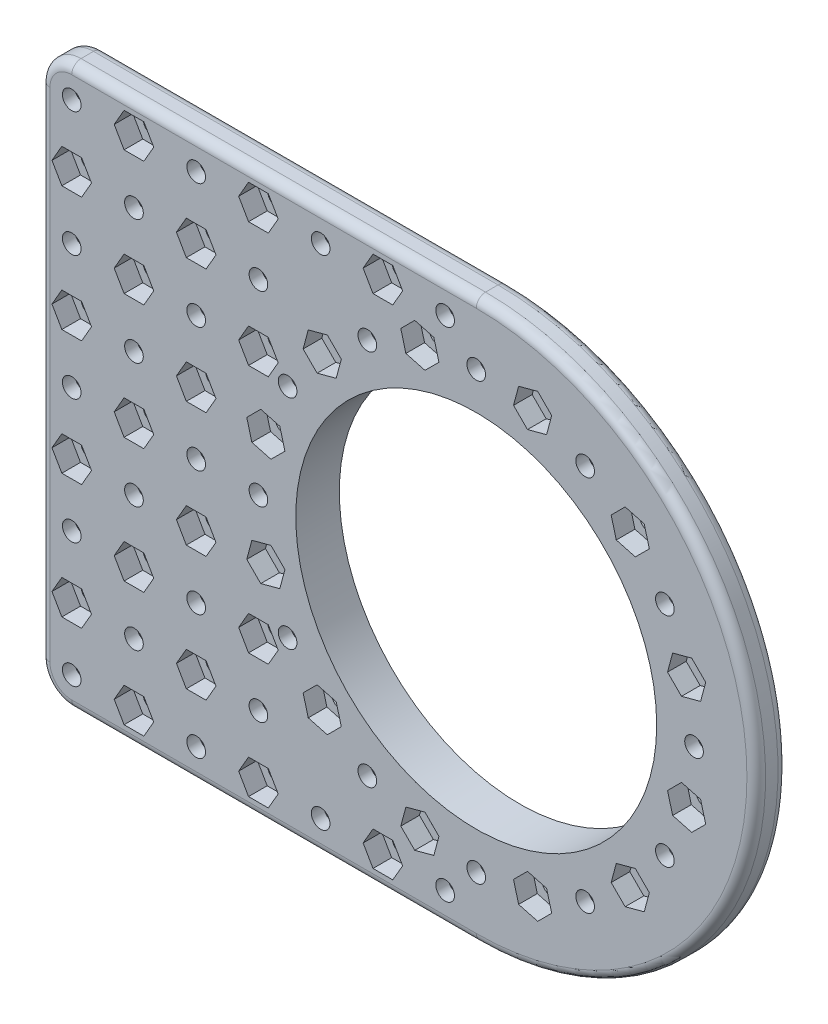
from build123d import *

# Parameters (mm, degrees)
EXTRUDE_1_DEPTH                   = 5
SKETCH_2_R                        = 29
CUT_EXTRUDE_1_DEPTH               = 92.923881554
SKETCH_3_R                        = 45
SKETCH_3_R_2                      = 29
EXTRUDE_2_DEPTH                   = 2
SKETCH_9_R                        = 45
SKETCH_9_R_2                      = 31
CUT_EXTRUDE_10_DEPTH              = 2
SKETCH_5_R                        = 1.5
CUT_EXTRUDE_2_DEPTH               = 92.923881554
CUT_EXTRUDE_3_DEPTH               = 3
SKETCH_10_R                       = 1.5
CUT_EXTRUDE_11_DEPTH              = 93.054331783
CUT_EXTRUDE_12_DEPTH              = 3
PATTERN_CIRCULAR_1_COUNT          = 12
SKETCH_12_R                       = 1.5
CUT_EXTRUDE_13_DEPTH              = 92.923881554
CUT_EXTRUDE_14_DEPTH              = 3
PATTERN_LINEAR_1_COUNT            = 5
PATTERN_LINEAR_1_PITCH            = 10
PATTERN_LINEAR_1_COL_COUNT        = 5
PATTERN_LINEAR_1_COL_PITCH        = 10
PATTERN_LINEAR_2_COUNT            = 3
PATTERN_LINEAR_2_PITCH            = 10
PATTERN_LINEAR_2_COPY_1_SKETCH_R  = 1.5
PATTERN_LINEAR_2_COPY_1_DEPTH     = 92.923881554
PATTERN_LINEAR_2_COPY_2_SKETCH_R  = 1.5
PATTERN_LINEAR_2_COPY_2_DEPTH     = 92.923881554
PATTERN_LINEAR_2_COPY_3_SKETCH_R  = 1.5
PATTERN_LINEAR_2_COPY_3_DEPTH     = 92.923881554
PATTERN_LINEAR_2_COPY_4_SKETCH_R  = 1.5
PATTERN_LINEAR_2_COPY_4_DEPTH     = 92.923881554
PATTERN_LINEAR_2_COPY_5_SKETCH_R  = 1.5
PATTERN_LINEAR_2_COPY_5_DEPTH     = 92.923881554
PATTERN_LINEAR_2_COPY_6_SKETCH_R  = 1.5
PATTERN_LINEAR_2_COPY_6_DEPTH     = 92.923881554
PATTERN_LINEAR_2_COPY_7_SKETCH_R  = 1.5
PATTERN_LINEAR_2_COPY_7_DEPTH     = 92.923881554
PATTERN_LINEAR_2_COPY_8_SKETCH_R  = 1.5
PATTERN_LINEAR_2_COPY_8_DEPTH     = 92.923881554
PATTERN_LINEAR_2_COPY_9_SKETCH_R  = 1.5
PATTERN_LINEAR_2_COPY_9_DEPTH     = 92.923881554
PATTERN_LINEAR_2_COPY_10_SKETCH_R = 1.5
PATTERN_LINEAR_2_COPY_10_DEPTH    = 92.923881554
PATTERN_LINEAR_2_COPY_11_SKETCH_R = 1.5
PATTERN_LINEAR_2_COPY_11_DEPTH    = 92.923881554
PATTERN_LINEAR_2_COPY_12_SKETCH_R = 1.5
PATTERN_LINEAR_2_COPY_12_DEPTH    = 92.923881554
PATTERN_LINEAR_2_COPY_13_SKETCH_R = 1.5
PATTERN_LINEAR_2_COPY_13_DEPTH    = 92.923881554
PATTERN_LINEAR_2_COPY_14_SKETCH_R = 1.5
PATTERN_LINEAR_2_COPY_14_DEPTH    = 92.923881554
PATTERN_LINEAR_2_COPY_15_SKETCH_R = 1.5
PATTERN_LINEAR_2_COPY_15_DEPTH    = 92.923881554
PATTERN_LINEAR_2_COPY_16_SKETCH_R = 1.5
PATTERN_LINEAR_2_COPY_16_DEPTH    = 92.923881554
PATTERN_LINEAR_3_COUNT            = 3
PATTERN_LINEAR_3_PITCH            = 20
PATTERN_LINEAR_3_COL_COUNT        = 3
PATTERN_LINEAR_3_COL_PITCH        = 20
CUT_EXTRUDE_16_DEPTH              = 3
PATTERN_LINEAR_5_COUNT            = 3
PATTERN_LINEAR_5_PITCH            = 20
PATTERN_LINEAR_5_COUNT_DIR2       = 3
PATTERN_LINEAR_5_PITCH_DIR2       = 20
PATTERN_LINEAR_4_COUNT            = 2
PATTERN_LINEAR_4_PITCH            = 20
PATTERN_LINEAR_4_COPY_1_DEPTH     = 3
PATTERN_LINEAR_4_COPY_2_DEPTH     = 3
PATTERN_LINEAR_4_COPY_3_DEPTH     = 3
PATTERN_LINEAR_4_COPY_4_DEPTH     = 3
PATTERN_LINEAR_4_COPY_5_DEPTH     = 3
PATTERN_LINEAR_4_COPY_6_DEPTH     = 3
PATTERN_LINEAR_4_COPY_7_DEPTH     = 3
PATTERN_LINEAR_4_COPY_8_DEPTH     = 3
PATTERN_LINEAR_4_COPY_9_DEPTH     = 3
PATTERN_LINEAR_4_COPY_10_DEPTH    = 3
PATTERN_LINEAR_4_COPY_11_DEPTH    = 3
PATTERN_LINEAR_4_COPY_12_DEPTH    = 3
SKETCH_14_R                       = 1.5
CUT_EXTRUDE_15_DEPTH              = 92.923881554
CUT_EXTRUDE_17_DEPTH              = 3
CUT_EXTRUDE_18_DEPTH              = 3
FILLET_4_R                        = 1.5
FILLET_5_R                        = 5


with BuildPart() as part:
    # 草图1 → 凸台-拉伸1 (new body)
    with BuildSketch(Plane.XY):
        with BuildLine():
            Line((-35, -45), (35, -45))
            ThreePointArc((35, -45), (80, 0), (35, 45))
            Line((35, 45), (-35, 45))
            Line((-35, 45), (-35, -45))
        make_face()
    extrude(amount=EXTRUDE_1_DEPTH)

    # 草图2 → 切除-拉伸1 (cut, through all)
    with BuildSketch(Plane.XY.offset(5)):
        with Locations((35, 0)):
            Circle(SKETCH_2_R)
    cut_extrude_1 = extrude(amount=-CUT_EXTRUDE_1_DEPTH, mode=Mode.SUBTRACT)

    # 草图3 → 凸台-拉伸2 (add)
    with BuildSketch(Plane.XY):
        with Locations(Location((35, 0, 0), (0, 0, 270))):
            Circle(SKETCH_3_R)
        with Locations((35, 0)):
            Circle(SKETCH_3_R_2, mode=Mode.SUBTRACT)
    extrude(amount=-EXTRUDE_2_DEPTH)

    # 草图9 → 切除-拉伸10 (cut)
    with BuildSketch(Plane(origin=(0, 0, -2), x_dir=(-1, 0, 0), z_dir=(0, 0, -1))):
        with Locations((-35, 0)):
            Circle(SKETCH_9_R)
        with Locations((-35, 0)):
            Circle(SKETCH_9_R_2, mode=Mode.SUBTRACT)
    extrude(amount=-CUT_EXTRUDE_10_DEPTH, mode=Mode.SUBTRACT)

    # 草图5 → 切除-拉伸2 (cut, through all)
    with BuildSketch(Plane(origin=(0, 0, 0), x_dir=(-1, 0, 0), z_dir=(0, 0, -1))):
        with Locations((-35, 35)):
            Circle(SKETCH_5_R)
    cut_extrude_2 = extrude(amount=-CUT_EXTRUDE_2_DEPTH, mode=Mode.SUBTRACT)

    # 草图6 → 切除-拉伸3 (cut)
    with BuildSketch(Plane(origin=(0, 0, 0), x_dir=(-1, 0, 0), z_dir=(0, 0, -1))):
        Polygon((-35, 31.824573519), (-32.25, 33.41228676), (-32.25, 36.58771324), (-35, 38.175426481), (-37.75, 36.58771324), (-37.75, 33.41228676), align=None)
    cut_extrude_3 = extrude(amount=-CUT_EXTRUDE_3_DEPTH, mode=Mode.SUBTRACT)

    # 草图10 → 切除-拉伸11 (cut, through all)
    with BuildSketch(Plane(origin=(0, 0, -2), x_dir=(-1, 0, 0), z_dir=(0, 0, -1))):
        with Locations((-25.941333421, 33.80740392)):
            Circle(SKETCH_10_R)
    cut_extrude_11 = extrude(amount=-CUT_EXTRUDE_11_DEPTH, mode=Mode.SUBTRACT)

    # 草图11 → 切除-拉伸12 (cut)
    with BuildSketch(Plane.XY.offset(5)):
        Polygon((26.763194271, 30.740177473), (29.008559868, 32.985543071), (28.186699019, 36.052769518), (25.119472572, 36.874630367), (22.874106974, 34.62926477), (23.695967824, 31.562038323), align=None)
    cut_extrude_12 = extrude(amount=-CUT_EXTRUDE_12_DEPTH, mode=Mode.SUBTRACT)

    # 阵列(圆周)1: 切除-拉伸1, 切除-拉伸2, 切除-拉伸3, 切除-拉伸11, 切除-拉伸12 ×12 about axis
    pattern_circular_1_axis = Axis((35, 0, 0), (0, 0, 1))
    add([cut_extrude_1.rotate(pattern_circular_1_axis, i * 360 / PATTERN_CIRCULAR_1_COUNT) for i in range(1, PATTERN_CIRCULAR_1_COUNT)], mode=Mode.SUBTRACT)
    add([cut_extrude_2.rotate(pattern_circular_1_axis, i * 360 / PATTERN_CIRCULAR_1_COUNT) for i in range(1, PATTERN_CIRCULAR_1_COUNT)], mode=Mode.SUBTRACT)
    add([cut_extrude_3.rotate(pattern_circular_1_axis, i * 360 / PATTERN_CIRCULAR_1_COUNT) for i in range(1, PATTERN_CIRCULAR_1_COUNT)], mode=Mode.SUBTRACT)
    add([cut_extrude_11.rotate(pattern_circular_1_axis, i * 360 / PATTERN_CIRCULAR_1_COUNT) for i in range(1, PATTERN_CIRCULAR_1_COUNT)], mode=Mode.SUBTRACT)
    add([cut_extrude_12.rotate(pattern_circular_1_axis, i * 360 / PATTERN_CIRCULAR_1_COUNT) for i in range(1, PATTERN_CIRCULAR_1_COUNT)], mode=Mode.SUBTRACT)

    # 草图12 → 切除-拉伸13 (cut, through all)
    with BuildSketch(Plane(origin=(0, 0, 0), x_dir=(-1, 0, 0), z_dir=(0, 0, -1))):
        with Locations((30, 0)):
            Circle(SKETCH_12_R)
    cut_extrude_13 = extrude(amount=-CUT_EXTRUDE_13_DEPTH, mode=Mode.SUBTRACT)

    # 草图13 → 切除-拉伸14 (cut)
    with BuildSketch(Plane(origin=(0, 0, 0), x_dir=(-1, 0, 0), z_dir=(0, 0, -1))):
        Polygon((26.824573519, 0), (28.41228676, -2.75), (31.58771324, -2.75), (33.175426481, 0), (31.58771324, 2.75), (28.41228676, 2.75), align=None)
    cut_extrude_14 = extrude(amount=-CUT_EXTRUDE_14_DEPTH, mode=Mode.SUBTRACT)

    # 阵列(线性)1: 切除-拉伸13 ×5
    with Locations(*[(0, -i * PATTERN_LINEAR_1_PITCH, 0) for i in range(1, PATTERN_LINEAR_1_COUNT)]):
        add(cut_extrude_13, mode=Mode.SUBTRACT)

    # 阵列(线性)1 col: 切除-拉伸13 ×5
    with Locations(*[(0, i * PATTERN_LINEAR_1_COL_PITCH, 0) for i in range(1, PATTERN_LINEAR_1_COL_COUNT)]):
        add(cut_extrude_13, mode=Mode.SUBTRACT)

    # 阵列(线性)2: 切除-拉伸13 ×3
    with Locations(*[(i * PATTERN_LINEAR_2_PITCH, 0, 0) for i in range(1, PATTERN_LINEAR_2_COUNT)]):
        add(cut_extrude_13, mode=Mode.SUBTRACT)

    # 阵列(线性)2 copy 1 sketch → 阵列(线性)2 copy 1 (cut, through all)
    with BuildSketch(Plane(origin=(10, -10, 0), x_dir=(-1, 0, 0), z_dir=(0, 0, -1))):
        with Locations((30, 0)):
            Circle(PATTERN_LINEAR_2_COPY_1_SKETCH_R)
    extrude(amount=-PATTERN_LINEAR_2_COPY_1_DEPTH, mode=Mode.SUBTRACT)

    # 阵列(线性)2 copy 2 sketch → 阵列(线性)2 copy 2 (cut, through all)
    with BuildSketch(Plane(origin=(20, -10, 0), x_dir=(-1, 0, 0), z_dir=(0, 0, -1))):
        with Locations((30, 0)):
            Circle(PATTERN_LINEAR_2_COPY_2_SKETCH_R)
    extrude(amount=-PATTERN_LINEAR_2_COPY_2_DEPTH, mode=Mode.SUBTRACT)

    # 阵列(线性)2 copy 3 sketch → 阵列(线性)2 copy 3 (cut, through all)
    with BuildSketch(Plane(origin=(10, -20, 0), x_dir=(-1, 0, 0), z_dir=(0, 0, -1))):
        with Locations((30, 0)):
            Circle(PATTERN_LINEAR_2_COPY_3_SKETCH_R)
    extrude(amount=-PATTERN_LINEAR_2_COPY_3_DEPTH, mode=Mode.SUBTRACT)

    # 阵列(线性)2 copy 4 sketch → 阵列(线性)2 copy 4 (cut, through all)
    with BuildSketch(Plane(origin=(20, -20, 0), x_dir=(-1, 0, 0), z_dir=(0, 0, -1))):
        with Locations((30, 0)):
            Circle(PATTERN_LINEAR_2_COPY_4_SKETCH_R)
    extrude(amount=-PATTERN_LINEAR_2_COPY_4_DEPTH, mode=Mode.SUBTRACT)

    # 阵列(线性)2 copy 5 sketch → 阵列(线性)2 copy 5 (cut, through all)
    with BuildSketch(Plane(origin=(10, -30, 0), x_dir=(-1, 0, 0), z_dir=(0, 0, -1))):
        with Locations((30, 0)):
            Circle(PATTERN_LINEAR_2_COPY_5_SKETCH_R)
    extrude(amount=-PATTERN_LINEAR_2_COPY_5_DEPTH, mode=Mode.SUBTRACT)

    # 阵列(线性)2 copy 6 sketch → 阵列(线性)2 copy 6 (cut, through all)
    with BuildSketch(Plane(origin=(20, -30, 0), x_dir=(-1, 0, 0), z_dir=(0, 0, -1))):
        with Locations((30, 0)):
            Circle(PATTERN_LINEAR_2_COPY_6_SKETCH_R)
    extrude(amount=-PATTERN_LINEAR_2_COPY_6_DEPTH, mode=Mode.SUBTRACT)

    # 阵列(线性)2 copy 7 sketch → 阵列(线性)2 copy 7 (cut, through all)
    with BuildSketch(Plane(origin=(10, -40, 0), x_dir=(-1, 0, 0), z_dir=(0, 0, -1))):
        with Locations((30, 0)):
            Circle(PATTERN_LINEAR_2_COPY_7_SKETCH_R)
    extrude(amount=-PATTERN_LINEAR_2_COPY_7_DEPTH, mode=Mode.SUBTRACT)

    # 阵列(线性)2 copy 8 sketch → 阵列(线性)2 copy 8 (cut, through all)
    with BuildSketch(Plane(origin=(20, -40, 0), x_dir=(-1, 0, 0), z_dir=(0, 0, -1))):
        with Locations((30, 0)):
            Circle(PATTERN_LINEAR_2_COPY_8_SKETCH_R)
    extrude(amount=-PATTERN_LINEAR_2_COPY_8_DEPTH, mode=Mode.SUBTRACT)

    # 阵列(线性)2 copy 9 sketch → 阵列(线性)2 copy 9 (cut, through all)
    with BuildSketch(Plane(origin=(10, 10, 0), x_dir=(-1, 0, 0), z_dir=(0, 0, -1))):
        with Locations((30, 0)):
            Circle(PATTERN_LINEAR_2_COPY_9_SKETCH_R)
    extrude(amount=-PATTERN_LINEAR_2_COPY_9_DEPTH, mode=Mode.SUBTRACT)

    # 阵列(线性)2 copy 10 sketch → 阵列(线性)2 copy 10 (cut, through all)
    with BuildSketch(Plane(origin=(20, 10, 0), x_dir=(-1, 0, 0), z_dir=(0, 0, -1))):
        with Locations((30, 0)):
            Circle(PATTERN_LINEAR_2_COPY_10_SKETCH_R)
    extrude(amount=-PATTERN_LINEAR_2_COPY_10_DEPTH, mode=Mode.SUBTRACT)

    # 阵列(线性)2 copy 11 sketch → 阵列(线性)2 copy 11 (cut, through all)
    with BuildSketch(Plane(origin=(10, 20, 0), x_dir=(-1, 0, 0), z_dir=(0, 0, -1))):
        with Locations((30, 0)):
            Circle(PATTERN_LINEAR_2_COPY_11_SKETCH_R)
    extrude(amount=-PATTERN_LINEAR_2_COPY_11_DEPTH, mode=Mode.SUBTRACT)

    # 阵列(线性)2 copy 12 sketch → 阵列(线性)2 copy 12 (cut, through all)
    with BuildSketch(Plane(origin=(20, 20, 0), x_dir=(-1, 0, 0), z_dir=(0, 0, -1))):
        with Locations((30, 0)):
            Circle(PATTERN_LINEAR_2_COPY_12_SKETCH_R)
    extrude(amount=-PATTERN_LINEAR_2_COPY_12_DEPTH, mode=Mode.SUBTRACT)

    # 阵列(线性)2 copy 13 sketch → 阵列(线性)2 copy 13 (cut, through all)
    with BuildSketch(Plane(origin=(10, 30, 0), x_dir=(-1, 0, 0), z_dir=(0, 0, -1))):
        with Locations((30, 0)):
            Circle(PATTERN_LINEAR_2_COPY_13_SKETCH_R)
    extrude(amount=-PATTERN_LINEAR_2_COPY_13_DEPTH, mode=Mode.SUBTRACT)

    # 阵列(线性)2 copy 14 sketch → 阵列(线性)2 copy 14 (cut, through all)
    with BuildSketch(Plane(origin=(20, 30, 0), x_dir=(-1, 0, 0), z_dir=(0, 0, -1))):
        with Locations((30, 0)):
            Circle(PATTERN_LINEAR_2_COPY_14_SKETCH_R)
    extrude(amount=-PATTERN_LINEAR_2_COPY_14_DEPTH, mode=Mode.SUBTRACT)

    # 阵列(线性)2 copy 15 sketch → 阵列(线性)2 copy 15 (cut, through all)
    with BuildSketch(Plane(origin=(10, 40, 0), x_dir=(-1, 0, 0), z_dir=(0, 0, -1))):
        with Locations((30, 0)):
            Circle(PATTERN_LINEAR_2_COPY_15_SKETCH_R)
    extrude(amount=-PATTERN_LINEAR_2_COPY_15_DEPTH, mode=Mode.SUBTRACT)

    # 阵列(线性)2 copy 16 sketch → 阵列(线性)2 copy 16 (cut, through all)
    with BuildSketch(Plane(origin=(20, 40, 0), x_dir=(-1, 0, 0), z_dir=(0, 0, -1))):
        with Locations((30, 0)):
            Circle(PATTERN_LINEAR_2_COPY_16_SKETCH_R)
    extrude(amount=-PATTERN_LINEAR_2_COPY_16_DEPTH, mode=Mode.SUBTRACT)

    # 阵列(线性)3: 切除-拉伸14 ×3
    with Locations(*[(0, -i * PATTERN_LINEAR_3_PITCH, 0) for i in range(1, PATTERN_LINEAR_3_COUNT)]):
        add(cut_extrude_14, mode=Mode.SUBTRACT)

    # 阵列(线性)3 col: 切除-拉伸14 ×3
    with Locations(*[(0, i * PATTERN_LINEAR_3_COL_PITCH, 0) for i in range(1, PATTERN_LINEAR_3_COL_COUNT)]):
        add(cut_extrude_14, mode=Mode.SUBTRACT)

    # 草图15 → 切除-拉伸16 (cut)
    with BuildSketch(Plane.XY.offset(5)):
        Polygon((-28.41228676, 7.25), (-26.824573519, 10), (-28.41228676, 12.75), (-31.58771324, 12.75), (-33.175426481, 10), (-31.58771324, 7.25), align=None)
    cut_extrude_16 = extrude(amount=-CUT_EXTRUDE_16_DEPTH, mode=Mode.SUBTRACT)

    # 阵列(线性)5: Cut-Extrude 16 3 × 3
    with Locations(*[Vector(0, -1, 0) * (i * PATTERN_LINEAR_5_PITCH) + Vector(0, 1, 0) * (j * PATTERN_LINEAR_5_PITCH_DIR2) for i in range(PATTERN_LINEAR_5_COUNT) for j in range(PATTERN_LINEAR_5_COUNT_DIR2) if (i, j) != (0, 0)]):
        add(cut_extrude_16, mode=Mode.SUBTRACT)

    # 阵列(线性)4: 切除-拉伸14, 切除-拉伸16 ×2
    with Locations(*[(i * PATTERN_LINEAR_4_PITCH, 0, 0) for i in range(1, PATTERN_LINEAR_4_COUNT)]):
        add(cut_extrude_14, mode=Mode.SUBTRACT)
        add(cut_extrude_16, mode=Mode.SUBTRACT)

    # 阵列(线性)4 copy 1 sketch → 阵列(线性)4 copy 1 (cut)
    with BuildSketch(Plane(origin=(20, -20, 0), x_dir=(-1, 0, 0), z_dir=(0, 0, -1))):
        Polygon((26.824573519, 0), (28.41228676, -2.75), (31.58771324, -2.75), (33.175426481, 0), (31.58771324, 2.75), (28.41228676, 2.75), align=None)
    extrude(amount=-PATTERN_LINEAR_4_COPY_1_DEPTH, mode=Mode.SUBTRACT)

    # 阵列(线性)4 copy 2 sketch → 阵列(线性)4 copy 2 (cut)
    with BuildSketch(Plane(origin=(20, -40, 0), x_dir=(-1, 0, 0), z_dir=(0, 0, -1))):
        Polygon((26.824573519, 0), (28.41228676, -2.75), (31.58771324, -2.75), (33.175426481, 0), (31.58771324, 2.75), (28.41228676, 2.75), align=None)
    extrude(amount=-PATTERN_LINEAR_4_COPY_2_DEPTH, mode=Mode.SUBTRACT)

    # 阵列(线性)4 copy 3 sketch → 阵列(线性)4 copy 3 (cut)
    with BuildSketch(Plane(origin=(20, 20, 0), x_dir=(-1, 0, 0), z_dir=(0, 0, -1))):
        Polygon((26.824573519, 0), (28.41228676, -2.75), (31.58771324, -2.75), (33.175426481, 0), (31.58771324, 2.75), (28.41228676, 2.75), align=None)
    extrude(amount=-PATTERN_LINEAR_4_COPY_3_DEPTH, mode=Mode.SUBTRACT)

    # 阵列(线性)4 copy 4 sketch → 阵列(线性)4 copy 4 (cut)
    with BuildSketch(Plane(origin=(20, 40, 0), x_dir=(-1, 0, 0), z_dir=(0, 0, -1))):
        Polygon((26.824573519, 0), (28.41228676, -2.75), (31.58771324, -2.75), (33.175426481, 0), (31.58771324, 2.75), (28.41228676, 2.75), align=None)
    extrude(amount=-PATTERN_LINEAR_4_COPY_4_DEPTH, mode=Mode.SUBTRACT)

    # 阵列(线性)4 copy 5 sketch → 阵列(线性)4 copy 5 (cut)
    with BuildSketch(Plane(origin=(20, 20, 5), x_dir=(1, 0, 0), z_dir=(0, 0, 1))):
        Polygon((-28.41228676, 7.25), (-26.824573519, 10), (-28.41228676, 12.75), (-31.58771324, 12.75), (-33.175426481, 10), (-31.58771324, 7.25), align=None)
    extrude(amount=-PATTERN_LINEAR_4_COPY_5_DEPTH, mode=Mode.SUBTRACT)

    # 阵列(线性)4 copy 6 sketch → 阵列(线性)4 copy 6 (cut)
    with BuildSketch(Plane(origin=(20, 40, 5), x_dir=(1, 0, 0), z_dir=(0, 0, 1))):
        Polygon((-28.41228676, 7.25), (-26.824573519, 10), (-28.41228676, 12.75), (-31.58771324, 12.75), (-33.175426481, 10), (-31.58771324, 7.25), align=None)
    extrude(amount=-PATTERN_LINEAR_4_COPY_6_DEPTH, mode=Mode.SUBTRACT)

    # 阵列(线性)4 copy 7 sketch → 阵列(线性)4 copy 7 (cut)
    with BuildSketch(Plane(origin=(20, -20, 5), x_dir=(1, 0, 0), z_dir=(0, 0, 1))):
        Polygon((-28.41228676, 7.25), (-26.824573519, 10), (-28.41228676, 12.75), (-31.58771324, 12.75), (-33.175426481, 10), (-31.58771324, 7.25), align=None)
    extrude(amount=-PATTERN_LINEAR_4_COPY_7_DEPTH, mode=Mode.SUBTRACT)

    # 阵列(线性)4 copy 8 sketch → 阵列(线性)4 copy 8 (cut)
    with BuildSketch(Plane(origin=(20, 0, 5), x_dir=(1, 0, 0), z_dir=(0, 0, 1))):
        Polygon((-28.41228676, 7.25), (-26.824573519, 10), (-28.41228676, 12.75), (-31.58771324, 12.75), (-33.175426481, 10), (-31.58771324, 7.25), align=None)
    extrude(amount=-PATTERN_LINEAR_4_COPY_8_DEPTH, mode=Mode.SUBTRACT)

    # 阵列(线性)4 copy 9 sketch → 阵列(线性)4 copy 9 (cut)
    with BuildSketch(Plane(origin=(20, 20, 5), x_dir=(1, 0, 0), z_dir=(0, 0, 1))):
        Polygon((-28.41228676, 7.25), (-26.824573519, 10), (-28.41228676, 12.75), (-31.58771324, 12.75), (-33.175426481, 10), (-31.58771324, 7.25), align=None)
    extrude(amount=-PATTERN_LINEAR_4_COPY_9_DEPTH, mode=Mode.SUBTRACT)

    # 阵列(线性)4 copy 10 sketch → 阵列(线性)4 copy 10 (cut)
    with BuildSketch(Plane(origin=(20, -40, 5), x_dir=(1, 0, 0), z_dir=(0, 0, 1))):
        Polygon((-28.41228676, 7.25), (-26.824573519, 10), (-28.41228676, 12.75), (-31.58771324, 12.75), (-33.175426481, 10), (-31.58771324, 7.25), align=None)
    extrude(amount=-PATTERN_LINEAR_4_COPY_10_DEPTH, mode=Mode.SUBTRACT)

    # 阵列(线性)4 copy 11 sketch → 阵列(线性)4 copy 11 (cut)
    with BuildSketch(Plane(origin=(20, -20, 5), x_dir=(1, 0, 0), z_dir=(0, 0, 1))):
        Polygon((-28.41228676, 7.25), (-26.824573519, 10), (-28.41228676, 12.75), (-31.58771324, 12.75), (-33.175426481, 10), (-31.58771324, 7.25), align=None)
    extrude(amount=-PATTERN_LINEAR_4_COPY_11_DEPTH, mode=Mode.SUBTRACT)

    # 阵列(线性)4 copy 12 sketch → 阵列(线性)4 copy 12 (cut)
    with BuildSketch(Plane(origin=(20, 0, 5), x_dir=(1, 0, 0), z_dir=(0, 0, 1))):
        Polygon((-28.41228676, 7.25), (-26.824573519, 10), (-28.41228676, 12.75), (-31.58771324, 12.75), (-33.175426481, 10), (-31.58771324, 7.25), align=None)
    extrude(amount=-PATTERN_LINEAR_4_COPY_12_DEPTH, mode=Mode.SUBTRACT)

    # 草图14 → 切除-拉伸15 (cut, through all)
    with BuildSketch(Plane(origin=(0, 0, 0), x_dir=(-1, 0, 0), z_dir=(0, 0, -1))):
        with Locations((0, 40)):
            Circle(SKETCH_14_R)
        with Locations((0, 30)):
            Circle(SKETCH_14_R)
        with Locations((-10, 40)):
            Circle(SKETCH_14_R)
        with Locations((-20, 40)):
            Circle(SKETCH_14_R)
        with Locations((0, 20)):
            Circle(SKETCH_14_R)
        with Locations((-30, 40)):
            Circle(SKETCH_14_R)
    cut_extrude_15 = extrude(amount=-CUT_EXTRUDE_15_DEPTH, mode=Mode.SUBTRACT)

    # 草图16 → 切除-拉伸17 (cut)
    with BuildSketch(Plane(origin=(0, 0, 0), x_dir=(-1, 0, 0), z_dir=(0, 0, -1))):
        Polygon((23.175426481, 30), (21.58771324, 32.75), (18.41228676, 32.75), (16.824573519, 30), (18.41228676, 27.25), (21.58771324, 27.25), align=None)
        Polygon((23.175426481, 10), (21.58771324, 12.75), (18.41228676, 12.75), (16.824573519, 10), (18.41228676, 7.25), (21.58771324, 7.25), align=None)
        Polygon((3.175426481, 30), (1.58771324, 32.75), (-1.58771324, 32.75), (-3.175426481, 30), (-1.58771324, 27.25), (1.58771324, 27.25), align=None)
        Polygon((-6.824573519, 40), (-8.41228676, 42.75), (-11.58771324, 42.75), (-13.175426481, 40), (-11.58771324, 37.25), (-8.41228676, 37.25), align=None)
        Polygon((-26.824573519, 40), (-28.41228676, 42.75), (-31.58771324, 42.75), (-33.175426481, 40), (-31.58771324, 37.25), (-28.41228676, 37.25), align=None)
    cut_extrude_17 = extrude(amount=-CUT_EXTRUDE_17_DEPTH, mode=Mode.SUBTRACT)

    # 草图17 → 切除-拉伸18 (cut)
    with BuildSketch(Plane.XY.offset(5)):
        Polygon((-16.824573519, 40), (-18.41228676, 42.75), (-21.58771324, 42.75), (-23.175426481, 40), (-21.58771324, 37.25), (-18.41228676, 37.25), align=None)
        Polygon((3.175426481, 40), (1.58771324, 42.75), (-1.58771324, 42.75), (-3.175426481, 40), (-1.58771324, 37.25), (1.58771324, 37.25), align=None)
        Polygon((23.175426481, 40), (21.58771324, 42.75), (18.41228676, 42.75), (16.824573519, 40), (18.41228676, 37.25), (21.58771324, 37.25), align=None)
        Polygon((-16.824573519, 20), (-18.41228676, 22.75), (-21.58771324, 22.75), (-23.175426481, 20), (-21.58771324, 17.25), (-18.41228676, 17.25), align=None)
        Polygon((-16.824573519, 0), (-18.41228676, 2.75), (-21.58771324, 2.75), (-23.175426481, 0), (-21.58771324, -2.75), (-18.41228676, -2.75), align=None)
        Polygon((3.175426481, 20), (1.58771324, 22.75), (-1.58771324, 22.75), (-3.175426481, 20), (-1.58771324, 17.25), (1.58771324, 17.25), align=None)
    cut_extrude_18 = extrude(amount=-CUT_EXTRUDE_18_DEPTH, mode=Mode.SUBTRACT)

    # 镜向1: 切除-拉伸15, 切除-拉伸17, 切除-拉伸18 across plane
    add(cut_extrude_15.mirror(Plane.ZX), mode=Mode.SUBTRACT)
    add(cut_extrude_17.mirror(Plane.ZX), mode=Mode.SUBTRACT)
    add(cut_extrude_18.mirror(Plane.ZX), mode=Mode.SUBTRACT)

    # 圆角4
    fillet_4_edges = [part.edges().sort_by_distance(p)[0] for p in [
        (-35, 0, 5),
        (0, -45, 5),
        (80, 0, 0),
        (80, 0, 5),
        (0, -45, 0),
        (-35, 0, 0),
        (0, 45, 0),
        (0, 45, 5),
    ]]
    fillet(fillet_4_edges, radius=FILLET_4_R)

    # 圆角5
    # the kernel refuses this fillet: 5 mm, written as the material it takes off along each edge
    with BuildSketch(Plane(origin=(-30, -40, 5), x_dir=(-1, 0, 0), z_dir=(0, 1, 0))) as fillet_5_piece_1:
        with BuildLine():
            CenterArc((3.5, -1.5), 1.5, 0, 90)
            Line((5, -1.5), (5, 0))
            Line((5, 0), (3.5, 0))
        make_face()
    revolve(axis=Axis((-30, -40, 5), (0, 0, 1)), revolution_arc=90, mode=Mode.SUBTRACT)
    with BuildSketch(Plane(origin=(-30, 40, 5), x_dir=(0, 1, 0), z_dir=(1, 0, 0))) as fillet_5_piece_2:
        with BuildLine():
            CenterArc((3.5, -1.5), 1.5, 0, 90)
            Line((5, -1.5), (5, 0))
            Line((5, 0), (3.5, 0))
        make_face()
    revolve(axis=Axis((-30, 40, 5), (0, 0, 1)), revolution_arc=90, mode=Mode.SUBTRACT)
    with BuildSketch(Plane(origin=(-30, 40, 0), x_dir=(-1, 0, 0), z_dir=(0, -1, 0))) as fillet_5_piece_3:
        with BuildLine():
            CenterArc((3.5, -1.5), 1.5, 0, 90)
            Line((5, -1.5), (5, 0))
            Line((5, 0), (3.5, 0))
        make_face()
    revolve(axis=Axis((-30, 40, 0), (0, 0, -1)), revolution_arc=90, mode=Mode.SUBTRACT)
    with BuildSketch(Plane(origin=(-30, -40, 0), x_dir=(0, -1, 0), z_dir=(1, 0, 0))) as fillet_5_piece_4:
        with BuildLine():
            CenterArc((3.5, -1.5), 1.5, 0, 90)
            Line((5, -1.5), (5, 0))
            Line((5, 0), (3.5, 0))
        make_face()
    revolve(axis=Axis((-30, -40, 0), (0, 0, -1)), revolution_arc=90, mode=Mode.SUBTRACT)
    with BuildSketch(Plane(origin=(-35, 45, 0), x_dir=(1, 0, 0), z_dir=(0, 0, 1)), Plane(origin=(-35, -45, 0), x_dir=(0, 1, 0), z_dir=(0, 0, 1))) as fillet_5_piece_5:
        with BuildLine():
            CenterArc((FILLET_5_R, -FILLET_5_R), FILLET_5_R, 90, 90)
            Line((0, -FILLET_5_R), (0, 0))
            Line((0, 0), (FILLET_5_R, 0))
        make_face()
    extrude(amount=5, mode=Mode.SUBTRACT)


solid = part.part
